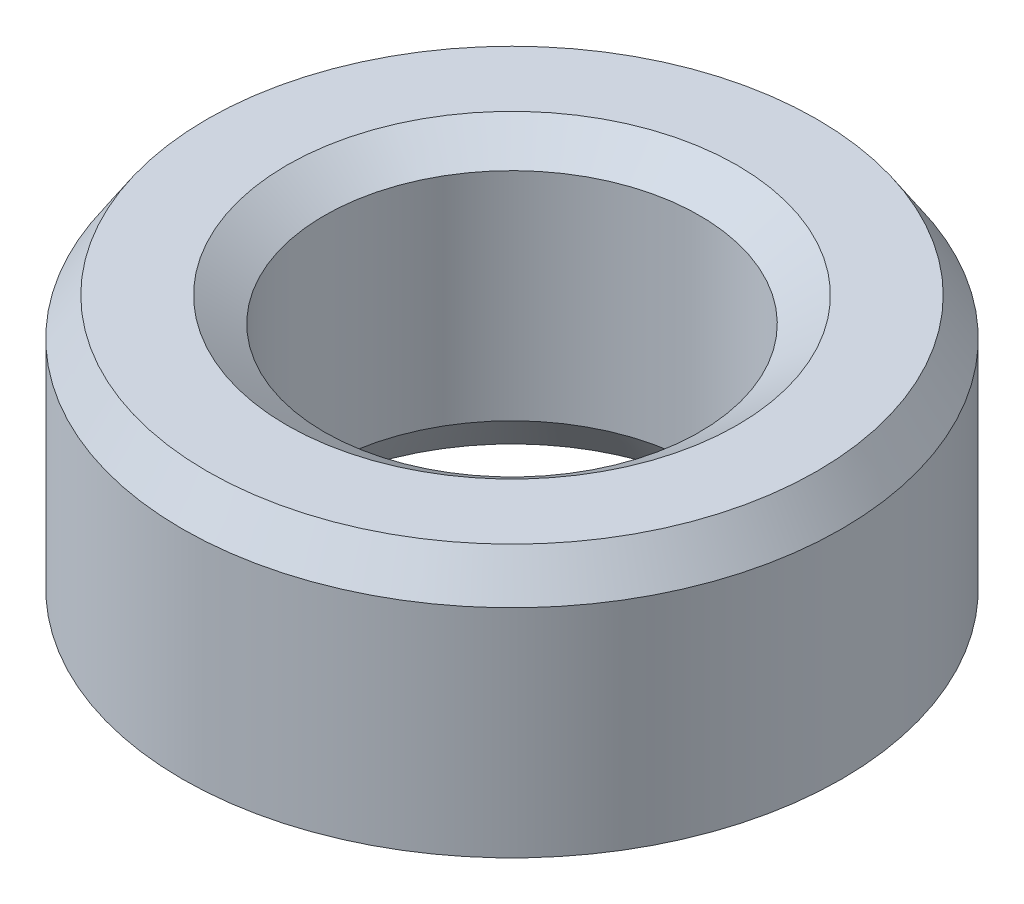
from build123d import *
from OCP.BRepFilletAPI import BRepFilletAPI_MakeChamfer

# Parameters (mm, degrees)
SKETCH1_R           = 22.5
BOSS_EXTRUDE1_DEPTH = 19.038197071
SKETCH2_R           = 12.802559387
CUT_EXTRUDE1_DEPTH  = 38.080357977
CHAMFER1_SIZE       = 2.564401589
CHAMFER1_SIZE2      = 1.690208733


with BuildPart() as part:
    # Sketch1 → Boss-Extrude1 (new body)
    with BuildSketch(Plane(origin=(0, 0, 0), x_dir=(1, 0, 0), z_dir=(0, 1, 0))):
        Circle(SKETCH1_R)
    extrude(amount=BOSS_EXTRUDE1_DEPTH)

    # Sketch2 → Cut-Extrude1 (cut, through all)
    with BuildSketch(Plane(origin=(0, 0, 0), x_dir=(1, 0, 0), z_dir=(0, 1, 0))):
        Circle(SKETCH2_R)
    extrude(amount=CUT_EXTRUDE1_DEPTH, mode=Mode.SUBTRACT)

    # Chamfer1: one chamfer whose edges measure the first distance from different faces: ONE call of the kernel's chamfer builder (chamfer() names one face for all edges)
    chamfer1_edges_1 = [part.edges().sort_by_distance(p)[0] for p in [
        (-12.802559387, 19.038197071, 0),
    ]]
    chamfer1_side_1 = [part.faces().sort_by_distance(p)[0] for p in [
        (-21.863603897, 19.038197071, 0),
    ]]
    chamfer1_edges_2 = [part.edges().sort_by_distance(p)[0] for p in [
        (-12.802559387, 0, 0),
    ]]
    chamfer1_side_2 = [part.faces().sort_by_distance(p)[0] for p in [
        (-12.802559387, 9.519098536, 0),
    ]]
    chamfer1_edges_3 = [part.edges().sort_by_distance(p)[0] for p in [
        (-22.5, 0, 0),
    ]]
    chamfer1_side_3 = [part.faces().sort_by_distance(p)[0] for p in [
        (-21.863603897, 0, 0),
    ]]
    chamfer1_edges_4 = [part.edges().sort_by_distance(p)[0] for p in [
        (-22.5, 19.038197071, 0),
    ]]
    chamfer1_side_4 = [part.faces().sort_by_distance(p)[0] for p in [
        (-22.5, 9.519098536, 0),
    ]]
    chamfer1 = BRepFilletAPI_MakeChamfer(part.part.solid().wrapped)
    for e in chamfer1_edges_1:
        chamfer1.Add(CHAMFER1_SIZE, CHAMFER1_SIZE2, e.wrapped, chamfer1_side_1[0].wrapped)  # the first distance lies on this face
    for e in chamfer1_edges_2:
        chamfer1.Add(CHAMFER1_SIZE, CHAMFER1_SIZE2, e.wrapped, chamfer1_side_2[0].wrapped)  # the first distance lies on this face
    for e in chamfer1_edges_3:
        chamfer1.Add(CHAMFER1_SIZE, CHAMFER1_SIZE2, e.wrapped, chamfer1_side_3[0].wrapped)  # the first distance lies on this face
    for e in chamfer1_edges_4:
        chamfer1.Add(CHAMFER1_SIZE, CHAMFER1_SIZE2, e.wrapped, chamfer1_side_4[0].wrapped)  # the first distance lies on this face
    add(Compound.cast(chamfer1.Shape()), mode=Mode.REPLACE)


solid = part.part
